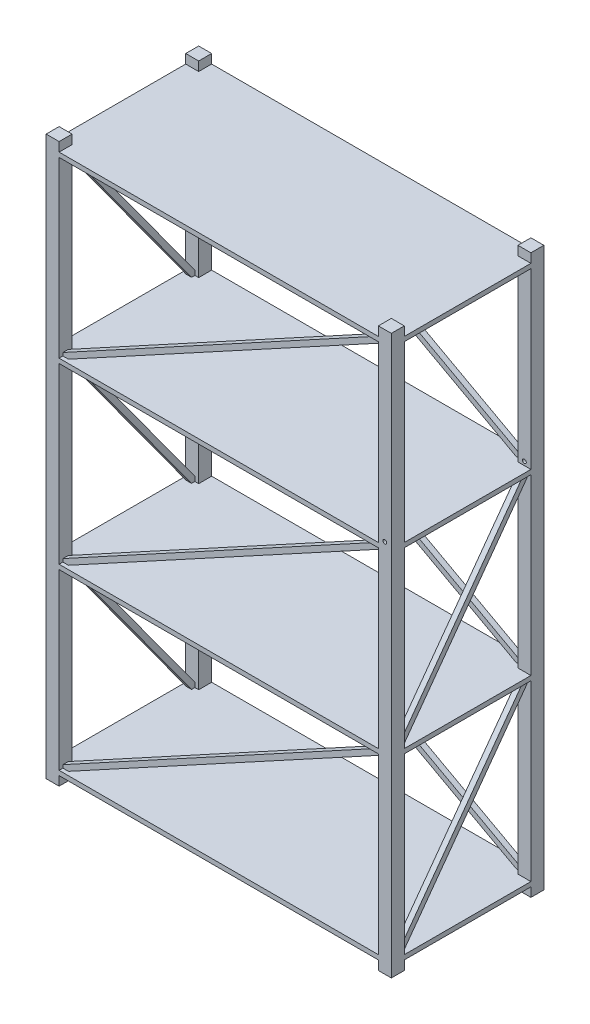
from build123d import *

# Parameters (mm, degrees)
SKETCH2_W               = 226.3
SKETCH2_H               = 100
BOSS_EXTRUDE1_DEPTH     = 183
SKETCH4_OUTSIDE_W       = 316.656
SKETCH4_OUTSIDE_H       = 190.356
SKETCH4_OUTSIDE_W_2     = 8.5
SKETCH4_OUTSIDE_H_2     = 8.5
CUT_EXTRUDE1_DEPTH      = 6
SKETCH5_W               = 209.3
SKETCH5_H               = 114
CUT_EXTRUDE2_DEPTH      = 238.259188442
SKETCH6_W               = 83
SKETCH6_H               = 114
CUT_EXTRUDE3_DEPTH      = 296.29762952
EXTRUDE_THIN1_START     = -2.5
EXTRUDE_THIN1_DEPTH     = 3.5
EXTRUDE_THIN2_START     = -2.5
EXTRUDE_THIN2_DEPTH     = 3.5
CIRPATTERN1_COUNT       = 2
DELETEFACE2_START       = 107.15
DELETEFACE2_DEPTH       = 3.5
CUT_EXTRUDE4_DEPTH      = 221.888937025
CUT_EXTRUDE4_DEPTH_BACK = 221.888937025
SKETCH9_R               = 1.25


# Read off the part's stored shape, not the designer's step: DeleteFace2
with BuildPart() as part:
    # Sketch2 → Boss-Extrude1 (new, symmetric)
    with BuildSketch(Plane(origin=(0, 0, 0), x_dir=(1, 0, 0), z_dir=(0, 1, 0))):
        Rectangle(SKETCH2_W, SKETCH2_H)
    extrude(amount=BOSS_EXTRUDE1_DEPTH, both=True)

    # Sketch4 outside → Cut-Extrude1 (cut)
    with BuildSketch(Plane.XZ.offset(183)):
        Rectangle(SKETCH4_OUTSIDE_W, SKETCH4_OUTSIDE_H)
        with Locations((-108.9, 45.75)):
            Rectangle(SKETCH4_OUTSIDE_W_2, SKETCH4_OUTSIDE_H_2, mode=Mode.SUBTRACT)
        with Locations((-108.9, -45.75)):
            Rectangle(SKETCH4_OUTSIDE_W_2, SKETCH4_OUTSIDE_H_2, mode=Mode.SUBTRACT)
        with Locations((108.9, -45.75)):
            Rectangle(SKETCH4_OUTSIDE_W_2, SKETCH4_OUTSIDE_H_2, mode=Mode.SUBTRACT)
        with Locations((108.9, 45.75)):
            Rectangle(SKETCH4_OUTSIDE_W_2, SKETCH4_OUTSIDE_H_2, mode=Mode.SUBTRACT)
    cut_extrude1 = extrude(amount=-CUT_EXTRUDE1_DEPTH, mode=Mode.SUBTRACT)

    # Mirror1: Cut-Extrude1 across plane
    add(cut_extrude1.mirror(Plane.ZX), mode=Mode.SUBTRACT)

    # Sketch5 → Cut-Extrude2 (cut, through all)
    with BuildSketch(Plane.XY.offset(50)):
        with Locations((0, 117)):
            Rectangle(SKETCH5_W, SKETCH5_H)
        with Locations((0, -117)):
            Rectangle(SKETCH5_W, SKETCH5_H)
        Rectangle(SKETCH5_W, SKETCH5_H)
    extrude(amount=-CUT_EXTRUDE2_DEPTH, mode=Mode.SUBTRACT)

    # Sketch6 → Cut-Extrude3 (cut, through all)
    with BuildSketch(Plane(origin=(113.15, 0, 0), x_dir=(0, 0, -1), z_dir=(1, 0, 0))):
        with Locations((0, 117)):
            Rectangle(SKETCH6_W, SKETCH6_H)
        with Locations((0, -117)):
            Rectangle(SKETCH6_W, SKETCH6_H)
        Rectangle(SKETCH6_W, SKETCH6_H)
    extrude(amount=-CUT_EXTRUDE3_DEPTH, mode=Mode.SUBTRACT)

    # Sketch7 → Extrude-Thin1 (add)
    with BuildSketch(Plane.XY.offset(50).offset(EXTRUDE_THIN1_START)):
        Polygon((-103.812934943, -175.536822075), (105.487065057, -61.536822075), (103.812934943, -58.463177925), (-105.487065057, -172.463177925), align=None)
        Polygon((-103.812934943, -58.536822075), (105.487065057, 55.463177925), (103.812934943, 58.536822075), (-105.487065057, -55.463177925), align=None)
        Polygon((-103.812934943, 58.463177925), (105.487065057, 172.463177925), (103.812934943, 175.536822075), (-105.487065057, 61.536822075), align=None)
    extrude_thin1 = extrude(amount=-EXTRUDE_THIN1_DEPTH)

    # Sketch8 → Extrude-Thin2 (add)
    with BuildSketch(Plane(origin=(113.15, 0, 0), x_dir=(0, 0, -1), z_dir=(1, 0, 0)).offset(EXTRUDE_THIN2_START)):
        Polygon((-40.085248698, -175.030038229), (42.914751302, -61.030038229), (40.085248698, -58.969961771), (-42.914751302, -172.969961771), align=None)
        Polygon((-40.085248698, -58.030038229), (42.914751302, 55.969961771), (40.085248698, 58.030038229), (-42.914751302, -55.969961771), align=None)
        Polygon((-40.085248698, 58.969961771), (42.914751302, 172.969961771), (40.085248698, 175.030038229), (-42.914751302, 61.030038229), align=None)
    extrude_thin2 = extrude(amount=-EXTRUDE_THIN2_DEPTH)

    # CirPattern1: Extrude-Thin1, Extrude-Thin2 ×2 about axis
    cirpattern1_axis = Axis((0, 0, 0), (0, 1, 0))
    add([extrude_thin1.rotate(cirpattern1_axis, i * 360 / CIRPATTERN1_COUNT) for i in range(1, CIRPATTERN1_COUNT)])
    add([extrude_thin2.rotate(cirpattern1_axis, i * 360 / CIRPATTERN1_COUNT) for i in range(1, CIRPATTERN1_COUNT)])

    # DeleteFace2 outline → DeleteFace2 (cut)
    with BuildSketch(Plane.YZ.offset(DELETEFACE2_START)):
        Polygon((60, 41.5), (60, 39.335308584), (171.02680938, -41.5), (174, -41.5), (174, -39.335308584), (62.97319062, 41.5), align=None)
    extrude(amount=DELETEFACE2_DEPTH, mode=Mode.SUBTRACT)

    # Sketch9 → Cut-Extrude4 (cut, two sides: drawn at the far end of the back side and taken through both)
    with BuildSketch(Plane.XY.offset(-CUT_EXTRUDE4_DEPTH_BACK)):
        with Locations((108.9, 62.5)):
            Circle(SKETCH9_R)
    extrude(amount=CUT_EXTRUDE4_DEPTH + CUT_EXTRUDE4_DEPTH_BACK, mode=Mode.SUBTRACT)


solid = part.part
